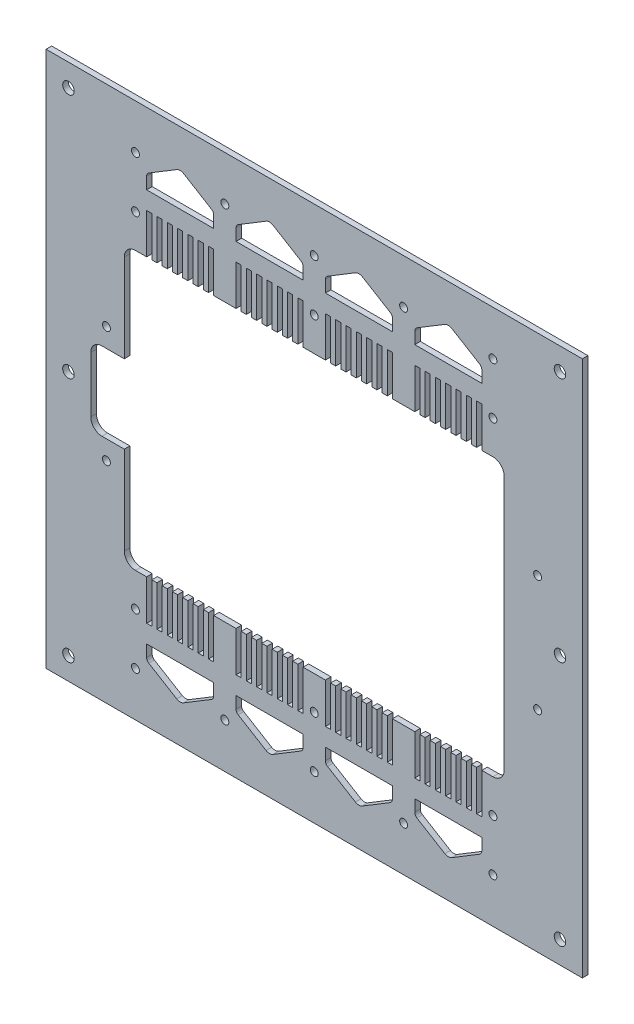
from build123d import *

# Parameters (mm, degrees)
SKETCH1_W           = 304.8
SKETCH1_H           = 304.8
SKETCH1_R           = 3.2639
SKETCH1_R_2         = 2.2479
BOSS_EXTRUDE1_DEPTH = 3.175


with BuildPart() as part:
    # Sketch1 → Boss-Extrude1 (new body)
    with BuildSketch(Plane.XY):
        Rectangle(SKETCH1_W, SKETCH1_H)
        with Locations((-139.7, -139.7)):
            Circle(SKETCH1_R, mode=Mode.SUBTRACT)
        with Locations((-101.6, -127)):
            Circle(SKETCH1_R_2, mode=Mode.SUBTRACT)
        with Locations((-101.6, -97.79)):
            Circle(SKETCH1_R_2, mode=Mode.SUBTRACT)
        with BuildLine():
            Line((-95.25, -118.477864985), (-95.25, -111.76))
            Line((-95.25, -111.76), (-57.15, -111.76))
            Line((-57.15, -111.76), (-57.15, -118.477864985))
            ThreePointArc((-57.15, -118.477864985), (-57.47688476, -119.724348412), (-58.37340231, -120.65))
            Line((-58.37340231, -120.65), (-74.225103465, -130.258202522))
            ThreePointArc((-74.225103465, -130.258202522), (-76.2, -130.81), (-78.174896535, -130.258202522))
            Line((-78.174896535, -130.258202522), (-94.02659769, -120.65))
            ThreePointArc((-94.02659769, -120.65), (-94.92311524, -119.724348412), (-95.25, -118.477864985))
        make_face(mode=Mode.SUBTRACT)
        with Locations((-50.8, -127)):
            Circle(SKETCH1_R_2, mode=Mode.SUBTRACT)
        with BuildLine():
            Line((-44.45, -118.477864985), (-44.45, -111.76))
            Line((-44.45, -111.76), (-6.35, -111.76))
            Line((-6.35, -111.76), (-6.35, -118.477864985))
            ThreePointArc((-6.35, -118.477864985), (-6.67688476, -119.724348412), (-7.57340231, -120.65))
            Line((-7.57340231, -120.65), (-23.425103465, -130.258202522))
            ThreePointArc((-23.425103465, -130.258202522), (-25.4, -130.81), (-27.374896535, -130.258202522))
            Line((-27.374896535, -130.258202522), (-43.22659769, -120.65))
            ThreePointArc((-43.22659769, -120.65), (-44.12311524, -119.724348412), (-44.45, -118.477864985))
        make_face(mode=Mode.SUBTRACT)
        with Locations((-118.11, -33.02)):
            Circle(SKETCH1_R_2, mode=Mode.SUBTRACT)
        with Locations((0, -127)):
            Circle(SKETCH1_R_2, mode=Mode.SUBTRACT)
        with BuildLine():
            Line((6.35, -118.477864985), (6.35, -111.76))
            Line((6.35, -111.76), (44.45, -111.76))
            Line((44.45, -111.76), (44.45, -118.477864985))
            ThreePointArc((44.45, -118.477864985), (44.12311524, -119.724348412), (43.22659769, -120.65))
            Line((43.22659769, -120.65), (27.374896535, -130.258202522))
            ThreePointArc((27.374896535, -130.258202522), (25.4, -130.81), (23.425103465, -130.258202522))
            Line((23.425103465, -130.258202522), (7.57340231, -120.65))
            ThreePointArc((7.57340231, -120.65), (6.67688476, -119.724348412), (6.35, -118.477864985))
        make_face(mode=Mode.SUBTRACT)
        with Locations((50.8, -127)):
            Circle(SKETCH1_R_2, mode=Mode.SUBTRACT)
        with BuildLine():
            Line((57.15, -118.477864985), (57.15, -111.76))
            Line((57.15, -111.76), (95.25, -111.76))
            Line((95.25, -111.76), (95.25, -118.477864985))
            ThreePointArc((95.25, -118.477864985), (94.92311524, -119.724348412), (94.02659769, -120.65))
            Line((94.02659769, -120.65), (78.174896535, -130.258202522))
            ThreePointArc((78.174896535, -130.258202522), (76.2, -130.81), (74.225103465, -130.258202522))
            Line((74.225103465, -130.258202522), (58.37340231, -120.65))
            ThreePointArc((58.37340231, -120.65), (57.47688476, -119.724348412), (57.15, -118.477864985))
        make_face(mode=Mode.SUBTRACT)
        with Locations((0, -97.79)):
            Circle(SKETCH1_R_2, mode=Mode.SUBTRACT)
        with Locations((101.6, -127)):
            Circle(SKETCH1_R_2, mode=Mode.SUBTRACT)
        with Locations((139.7, -139.7)):
            Circle(SKETCH1_R, mode=Mode.SUBTRACT)
        with Locations((101.6, -97.79)):
            Circle(SKETCH1_R_2, mode=Mode.SUBTRACT)
        with Locations((127, -33.02)):
            Circle(SKETCH1_R_2, mode=Mode.SUBTRACT)
        with Locations((-139.7, 0)):
            Circle(SKETCH1_R, mode=Mode.SUBTRACT)
        with Locations((-118.11, 33.02)):
            Circle(SKETCH1_R_2, mode=Mode.SUBTRACT)
        with BuildLine():
            Line((-95.25, 78.74), (-95.25, 101.6))
            Line((-95.25, 101.6), (-92.319230769, 101.6))
            Line((-92.319230769, 101.6), (-92.319230769, 78.74))
            Line((-92.319230769, 78.74), (-89.388461538, 78.74))
            Line((-89.388461538, 78.74), (-89.388461538, 101.6))
            Line((-89.388461538, 101.6), (-86.457692308, 101.6))
            Line((-86.457692308, 101.6), (-86.457692308, 78.74))
            Line((-86.457692308, 78.74), (-83.526923077, 78.74))
            Line((-83.526923077, 78.74), (-83.526923077, 101.6))
            Line((-83.526923077, 101.6), (-80.596153846, 101.6))
            Line((-80.596153846, 101.6), (-80.596153846, 78.74))
            Line((-80.596153846, 78.74), (-77.665384615, 78.74))
            Line((-77.665384615, 78.74), (-77.665384615, 101.6))
            Line((-77.665384615, 101.6), (-74.734615385, 101.6))
            Line((-74.734615385, 101.6), (-74.734615385, 78.74))
            Line((-74.734615385, 78.74), (-71.803846154, 78.74))
            Line((-71.803846154, 78.74), (-71.803846154, 101.6))
            Line((-71.803846154, 101.6), (-68.873076923, 101.6))
            Line((-68.873076923, 101.6), (-68.873076923, 78.74))
            Line((-68.873076923, 78.74), (-65.942307692, 78.74))
            Line((-65.942307692, 78.74), (-65.942307692, 101.6))
            Line((-65.942307692, 101.6), (-63.011538462, 101.6))
            Line((-63.011538462, 101.6), (-63.011538462, 78.74))
            Line((-63.011538462, 78.74), (-60.080769231, 78.74))
            Line((-60.080769231, 78.74), (-60.080769231, 101.6))
            Line((-60.080769231, 101.6), (-57.15, 101.6))
            Line((-57.15, 101.6), (-57.15, 78.74))
            Line((-57.15, 78.74), (-44.45, 78.74))
            Line((-44.45, 78.74), (-44.45, 101.6))
            Line((-44.45, 101.6), (-41.519230769, 101.6))
            Line((-41.519230769, 101.6), (-41.519230769, 78.74))
            Line((-41.519230769, 78.74), (-38.588461538, 78.74))
            Line((-38.588461538, 78.74), (-38.588461538, 101.6))
            Line((-38.588461538, 101.6), (-35.657692308, 101.6))
            Line((-35.657692308, 101.6), (-35.657692308, 78.74))
            Line((-35.657692308, 78.74), (-32.726923077, 78.74))
            Line((-32.726923077, 78.74), (-32.726923077, 101.6))
            Line((-32.726923077, 101.6), (-29.796153846, 101.6))
            Line((-29.796153846, 101.6), (-29.796153846, 78.74))
            Line((-29.796153846, 78.74), (-26.865384615, 78.74))
            Line((-26.865384615, 78.74), (-26.865384615, 101.6))
            Line((-26.865384615, 101.6), (-23.934615385, 101.6))
            Line((-23.934615385, 101.6), (-23.934615385, 78.74))
            Line((-23.934615385, 78.74), (-21.003846154, 78.74))
            Line((-21.003846154, 78.74), (-21.003846154, 101.6))
            Line((-21.003846154, 101.6), (-18.073076923, 101.6))
            Line((-18.073076923, 101.6), (-18.073076923, 78.74))
            Line((-18.073076923, 78.74), (-15.142307692, 78.74))
            Line((-15.142307692, 78.74), (-15.142307692, 101.6))
            Line((-15.142307692, 101.6), (-12.211538462, 101.6))
            Line((-12.211538462, 101.6), (-12.211538462, 78.74))
            Line((-12.211538462, 78.74), (-9.280769231, 78.74))
            Line((-9.280769231, 78.74), (-9.280769231, 101.6))
            Line((-9.280769231, 101.6), (-6.35, 101.6))
            Line((-6.35, 101.6), (-6.35, 78.74))
            Line((-6.35, 78.74), (6.35, 78.74))
            Line((6.35, 78.74), (6.35, 101.6))
            Line((6.35, 101.6), (9.280769231, 101.6))
            Line((9.280769231, 101.6), (9.280769231, 78.74))
            Line((9.280769231, 78.74), (12.211538462, 78.74))
            Line((12.211538462, 78.74), (12.211538462, 101.6))
            Line((12.211538462, 101.6), (15.142307692, 101.6))
            Line((15.142307692, 101.6), (15.142307692, 78.74))
            Line((15.142307692, 78.74), (18.073076923, 78.74))
            Line((18.073076923, 78.74), (18.073076923, 101.6))
            Line((18.073076923, 101.6), (21.003846154, 101.6))
            Line((21.003846154, 101.6), (21.003846154, 78.74))
            Line((21.003846154, 78.74), (23.934615385, 78.74))
            Line((23.934615385, 78.74), (23.934615385, 101.6))
            Line((23.934615385, 101.6), (26.865384615, 101.6))
            Line((26.865384615, 101.6), (26.865384615, 78.74))
            Line((26.865384615, 78.74), (29.796153846, 78.74))
            Line((29.796153846, 78.74), (29.796153846, 101.6))
            Line((29.796153846, 101.6), (32.726923077, 101.6))
            Line((32.726923077, 101.6), (32.726923077, 78.74))
            Line((32.726923077, 78.74), (35.657692308, 78.74))
            Line((35.657692308, 78.74), (35.657692308, 101.6))
            Line((35.657692308, 101.6), (38.588461538, 101.6))
            Line((38.588461538, 101.6), (38.588461538, 78.74))
            Line((38.588461538, 78.74), (41.519230769, 78.74))
            Line((41.519230769, 78.74), (41.519230769, 101.6))
            Line((41.519230769, 101.6), (44.45, 101.6))
            Line((44.45, 101.6), (44.45, 78.74))
            Line((44.45, 78.74), (57.15, 78.74))
            Line((57.15, 78.74), (57.15, 101.6))
            Line((57.15, 101.6), (60.080769231, 101.6))
            Line((60.080769231, 101.6), (60.080769231, 78.74))
            Line((60.080769231, 78.74), (63.011538462, 78.74))
            Line((63.011538462, 78.74), (63.011538462, 101.6))
            Line((63.011538462, 101.6), (65.942307692, 101.6))
            Line((65.942307692, 101.6), (65.942307692, 78.74))
            Line((65.942307692, 78.74), (68.873076923, 78.74))
            Line((68.873076923, 78.74), (68.873076923, 101.6))
            Line((68.873076923, 101.6), (71.803846154, 101.6))
            Line((71.803846154, 101.6), (71.803846154, 78.74))
            Line((71.803846154, 78.74), (74.734615385, 78.74))
            Line((74.734615385, 78.74), (74.734615385, 101.6))
            Line((74.734615385, 101.6), (77.665384615, 101.6))
            Line((77.665384615, 101.6), (77.665384615, 78.74))
            Line((77.665384615, 78.74), (80.596153846, 78.74))
            Line((80.596153846, 78.74), (80.596153846, 101.6))
            Line((80.596153846, 101.6), (83.526923077, 101.6))
            Line((83.526923077, 101.6), (83.526923077, 78.74))
            Line((83.526923077, 78.74), (86.457692308, 78.74))
            Line((86.457692308, 78.74), (86.457692308, 101.6))
            Line((86.457692308, 101.6), (89.388461538, 101.6))
            Line((89.388461538, 101.6), (89.388461538, 78.74))
            Line((89.388461538, 78.74), (92.319230769, 78.74))
            Line((92.319230769, 78.74), (92.319230769, 101.6))
            Line((92.319230769, 101.6), (95.25, 101.6))
            Line((95.25, 101.6), (95.25, 78.74))
            Line((95.25, 78.74), (101.6, 78.74))
            ThreePointArc((101.6, 78.74), (106.090128061, 76.880128061), (107.95, 72.39))
            Line((107.95, 72.39), (107.95, -72.39))
            ThreePointArc((107.95, -72.39), (106.090128061, -76.880128061), (101.6, -78.74))
            Line((101.6, -78.74), (95.25, -78.74))
            Line((95.25, -78.74), (95.25, -101.6))
            Line((95.25, -101.6), (92.319230769, -101.6))
            Line((92.319230769, -101.6), (92.319230769, -78.74))
            Line((92.319230769, -78.74), (89.388461538, -78.74))
            Line((89.388461538, -78.74), (89.388461538, -101.6))
            Line((89.388461538, -101.6), (86.457692308, -101.6))
            Line((86.457692308, -101.6), (86.457692308, -78.74))
            Line((86.457692308, -78.74), (83.526923077, -78.74))
            Line((83.526923077, -78.74), (83.526923077, -101.6))
            Line((83.526923077, -101.6), (80.596153846, -101.6))
            Line((80.596153846, -101.6), (80.596153846, -78.74))
            Line((80.596153846, -78.74), (77.665384615, -78.74))
            Line((77.665384615, -78.74), (77.665384615, -101.6))
            Line((77.665384615, -101.6), (74.734615385, -101.6))
            Line((74.734615385, -101.6), (74.734615385, -78.74))
            Line((74.734615385, -78.74), (71.803846154, -78.74))
            Line((71.803846154, -78.74), (71.803846154, -101.6))
            Line((71.803846154, -101.6), (68.873076923, -101.6))
            Line((68.873076923, -101.6), (68.873076923, -78.74))
            Line((68.873076923, -78.74), (65.942307692, -78.74))
            Line((65.942307692, -78.74), (65.942307692, -101.6))
            Line((65.942307692, -101.6), (63.011538462, -101.6))
            Line((63.011538462, -101.6), (63.011538462, -78.74))
            Line((63.011538462, -78.74), (60.080769231, -78.74))
            Line((60.080769231, -78.74), (60.080769231, -101.6))
            Line((60.080769231, -101.6), (57.15, -101.6))
            Line((57.15, -101.6), (57.15, -78.74))
            Line((57.15, -78.74), (44.45, -78.74))
            Line((44.45, -78.74), (44.45, -101.6))
            Line((44.45, -101.6), (41.519230769, -101.6))
            Line((41.519230769, -101.6), (41.519230769, -78.74))
            Line((41.519230769, -78.74), (38.588461538, -78.74))
            Line((38.588461538, -78.74), (38.588461538, -101.6))
            Line((38.588461538, -101.6), (35.657692308, -101.6))
            Line((35.657692308, -101.6), (35.657692308, -78.74))
            Line((35.657692308, -78.74), (32.726923077, -78.74))
            Line((32.726923077, -78.74), (32.726923077, -101.6))
            Line((32.726923077, -101.6), (29.796153846, -101.6))
            Line((29.796153846, -101.6), (29.796153846, -78.74))
            Line((29.796153846, -78.74), (26.865384615, -78.74))
            Line((26.865384615, -78.74), (26.865384615, -101.6))
            Line((26.865384615, -101.6), (23.934615385, -101.6))
            Line((23.934615385, -101.6), (23.934615385, -78.74))
            Line((23.934615385, -78.74), (21.003846154, -78.74))
            Line((21.003846154, -78.74), (21.003846154, -101.6))
            Line((21.003846154, -101.6), (18.073076923, -101.6))
            Line((18.073076923, -101.6), (18.073076923, -78.74))
            Line((18.073076923, -78.74), (15.142307692, -78.74))
            Line((15.142307692, -78.74), (15.142307692, -101.6))
            Line((15.142307692, -101.6), (12.211538462, -101.6))
            Line((12.211538462, -101.6), (12.211538462, -78.74))
            Line((12.211538462, -78.74), (9.280769231, -78.74))
            Line((9.280769231, -78.74), (9.280769231, -101.6))
            Line((9.280769231, -101.6), (6.35, -101.6))
            Line((6.35, -101.6), (6.35, -78.74))
            Line((6.35, -78.74), (-6.35, -78.74))
            Line((-6.35, -78.74), (-6.35, -101.6))
            Line((-6.35, -101.6), (-9.280769231, -101.6))
            Line((-9.280769231, -101.6), (-9.280769231, -78.74))
            Line((-9.280769231, -78.74), (-12.211538462, -78.74))
            Line((-12.211538462, -78.74), (-12.211538462, -101.6))
            Line((-12.211538462, -101.6), (-15.142307692, -101.6))
            Line((-15.142307692, -101.6), (-15.142307692, -78.74))
            Line((-15.142307692, -78.74), (-18.073076923, -78.74))
            Line((-18.073076923, -78.74), (-18.073076923, -101.6))
            Line((-18.073076923, -101.6), (-21.003846154, -101.6))
            Line((-21.003846154, -101.6), (-21.003846154, -78.74))
            Line((-21.003846154, -78.74), (-23.934615385, -78.74))
            Line((-23.934615385, -78.74), (-23.934615385, -101.6))
            Line((-23.934615385, -101.6), (-26.865384615, -101.6))
            Line((-26.865384615, -101.6), (-26.865384615, -78.74))
            Line((-26.865384615, -78.74), (-29.796153846, -78.74))
            Line((-29.796153846, -78.74), (-29.796153846, -101.6))
            Line((-29.796153846, -101.6), (-32.726923077, -101.6))
            Line((-32.726923077, -101.6), (-32.726923077, -78.74))
            Line((-32.726923077, -78.74), (-35.657692308, -78.74))
            Line((-35.657692308, -78.74), (-35.657692308, -101.6))
            Line((-35.657692308, -101.6), (-38.588461538, -101.6))
            Line((-38.588461538, -101.6), (-38.588461538, -78.74))
            Line((-38.588461538, -78.74), (-41.519230769, -78.74))
            Line((-41.519230769, -78.74), (-41.519230769, -101.6))
            Line((-41.519230769, -101.6), (-44.45, -101.6))
            Line((-44.45, -101.6), (-44.45, -78.74))
            Line((-44.45, -78.74), (-57.15, -78.74))
            Line((-57.15, -78.74), (-57.15, -101.6))
            Line((-57.15, -101.6), (-60.080769231, -101.6))
            Line((-60.080769231, -101.6), (-60.080769231, -78.74))
            Line((-60.080769231, -78.74), (-63.011538462, -78.74))
            Line((-63.011538462, -78.74), (-63.011538462, -101.6))
            Line((-63.011538462, -101.6), (-65.942307692, -101.6))
            Line((-65.942307692, -101.6), (-65.942307692, -78.74))
            Line((-65.942307692, -78.74), (-68.873076923, -78.74))
            Line((-68.873076923, -78.74), (-68.873076923, -101.6))
            Line((-68.873076923, -101.6), (-71.803846154, -101.6))
            Line((-71.803846154, -101.6), (-71.803846154, -78.74))
            Line((-71.803846154, -78.74), (-74.734615385, -78.74))
            Line((-74.734615385, -78.74), (-74.734615385, -101.6))
            Line((-74.734615385, -101.6), (-77.665384615, -101.6))
            Line((-77.665384615, -101.6), (-77.665384615, -78.74))
            Line((-77.665384615, -78.74), (-80.596153846, -78.74))
            Line((-80.596153846, -78.74), (-80.596153846, -101.6))
            Line((-80.596153846, -101.6), (-83.526923077, -101.6))
            Line((-83.526923077, -101.6), (-83.526923077, -78.74))
            Line((-83.526923077, -78.74), (-86.457692308, -78.74))
            Line((-86.457692308, -78.74), (-86.457692308, -101.6))
            Line((-86.457692308, -101.6), (-89.388461538, -101.6))
            Line((-89.388461538, -101.6), (-89.388461538, -78.74))
            Line((-89.388461538, -78.74), (-92.319230769, -78.74))
            Line((-92.319230769, -78.74), (-92.319230769, -101.6))
            Line((-92.319230769, -101.6), (-95.25, -101.6))
            Line((-95.25, -101.6), (-95.25, -78.74))
            Line((-95.25, -78.74), (-101.6, -78.74))
            ThreePointArc((-101.6, -78.74), (-106.090128061, -76.880128061), (-107.95, -72.39))
            Line((-107.95, -72.39), (-107.95, -22.225))
            Line((-107.95, -22.225), (-120.65, -22.225))
            ThreePointArc((-120.65, -22.225), (-125.140128061, -20.365128061), (-127, -15.875))
            Line((-127, -15.875), (-127, 15.875))
            ThreePointArc((-127, 15.875), (-125.140128061, 20.365128061), (-120.65, 22.225))
            Line((-120.65, 22.225), (-107.95, 22.225))
            Line((-107.95, 22.225), (-107.95, 72.39))
            ThreePointArc((-107.95, 72.39), (-106.090128061, 76.880128061), (-101.6, 78.74))
            Line((-101.6, 78.74), (-95.25, 78.74))
        make_face(mode=Mode.SUBTRACT)
        with Locations((-101.6, 97.79)):
            Circle(SKETCH1_R_2, mode=Mode.SUBTRACT)
        with Locations((-139.7, 139.7)):
            Circle(SKETCH1_R, mode=Mode.SUBTRACT)
        with Locations((-101.6, 127)):
            Circle(SKETCH1_R_2, mode=Mode.SUBTRACT)
        with BuildLine():
            Line((-57.15, 111.76), (-95.25, 111.76))
            Line((-95.25, 111.76), (-95.25, 118.477864985))
            ThreePointArc((-95.25, 118.477864985), (-94.92311524, 119.724348412), (-94.02659769, 120.65))
            Line((-94.02659769, 120.65), (-78.174896535, 130.258202522))
            ThreePointArc((-78.174896535, 130.258202522), (-76.2, 130.81), (-74.225103465, 130.258202522))
            Line((-74.225103465, 130.258202522), (-58.37340231, 120.65))
            ThreePointArc((-58.37340231, 120.65), (-57.47688476, 119.724348412), (-57.15, 118.477864985))
            Line((-57.15, 118.477864985), (-57.15, 111.76))
        make_face(mode=Mode.SUBTRACT)
        with Locations((-50.8, 127)):
            Circle(SKETCH1_R_2, mode=Mode.SUBTRACT)
        with BuildLine():
            Line((-6.35, 118.477864985), (-6.35, 111.76))
            Line((-6.35, 111.76), (-44.45, 111.76))
            Line((-44.45, 111.76), (-44.45, 118.477864985))
            ThreePointArc((-44.45, 118.477864985), (-44.12311524, 119.724348412), (-43.22659769, 120.65))
            Line((-43.22659769, 120.65), (-27.374896535, 130.258202522))
            ThreePointArc((-27.374896535, 130.258202522), (-25.4, 130.81), (-23.425103465, 130.258202522))
            Line((-23.425103465, 130.258202522), (-7.57340231, 120.65))
            ThreePointArc((-7.57340231, 120.65), (-6.67688476, 119.724348412), (-6.35, 118.477864985))
        make_face(mode=Mode.SUBTRACT)
        with Locations((139.7, 0)):
            Circle(SKETCH1_R, mode=Mode.SUBTRACT)
        with Locations((127, 33.02)):
            Circle(SKETCH1_R_2, mode=Mode.SUBTRACT)
        with Locations((0, 97.79)):
            Circle(SKETCH1_R_2, mode=Mode.SUBTRACT)
        with Locations((0, 127)):
            Circle(SKETCH1_R_2, mode=Mode.SUBTRACT)
        with BuildLine():
            Line((44.45, 118.477864985), (44.45, 111.76))
            Line((44.45, 111.76), (6.35, 111.76))
            Line((6.35, 111.76), (6.35, 118.477864985))
            ThreePointArc((6.35, 118.477864985), (6.67688476, 119.724348412), (7.57340231, 120.65))
            Line((7.57340231, 120.65), (23.425103465, 130.258202522))
            ThreePointArc((23.425103465, 130.258202522), (25.4, 130.81), (27.374896535, 130.258202522))
            Line((27.374896535, 130.258202522), (43.22659769, 120.65))
            ThreePointArc((43.22659769, 120.65), (44.12311524, 119.724348412), (44.45, 118.477864985))
        make_face(mode=Mode.SUBTRACT)
        with Locations((50.8, 127)):
            Circle(SKETCH1_R_2, mode=Mode.SUBTRACT)
        with Locations((101.6, 97.79)):
            Circle(SKETCH1_R_2, mode=Mode.SUBTRACT)
        with BuildLine():
            Line((95.25, 118.477864985), (95.25, 111.76))
            Line((95.25, 111.76), (57.15, 111.76))
            Line((57.15, 111.76), (57.15, 118.477864985))
            ThreePointArc((57.15, 118.477864985), (57.47688476, 119.724348412), (58.37340231, 120.65))
            Line((58.37340231, 120.65), (74.225103465, 130.258202522))
            ThreePointArc((74.225103465, 130.258202522), (76.2, 130.81), (78.174896535, 130.258202522))
            Line((78.174896535, 130.258202522), (94.02659769, 120.65))
            ThreePointArc((94.02659769, 120.65), (94.92311524, 119.724348412), (95.25, 118.477864985))
        make_face(mode=Mode.SUBTRACT)
        with Locations((101.6, 127)):
            Circle(SKETCH1_R_2, mode=Mode.SUBTRACT)
        with Locations((139.7, 139.7)):
            Circle(SKETCH1_R, mode=Mode.SUBTRACT)
    extrude(amount=BOSS_EXTRUDE1_DEPTH)


solid = part.part
